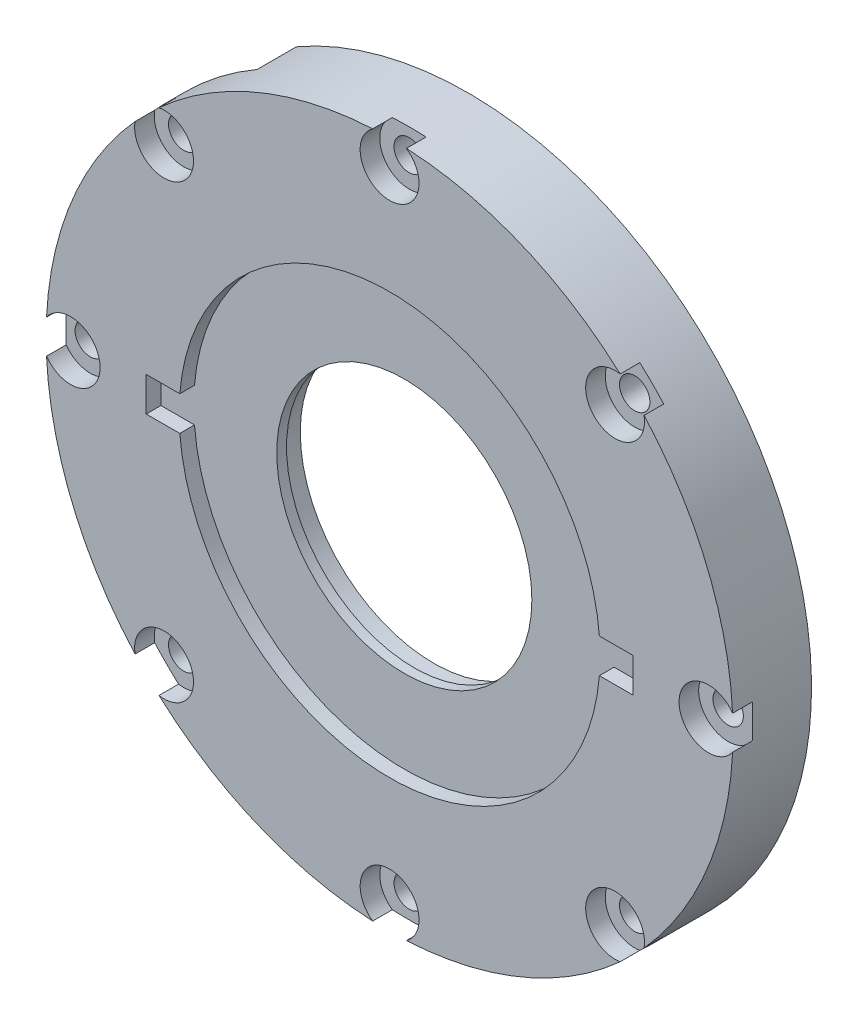
from build123d import *

# Parameters (mm, degrees)
EXTRUDE_1_OUTLINE_R   = 35
EXTRUDE_1_OUTLINE_R_2 = 1.55
EXTRUDE_1_OUTLINE_R_3 = 30.05
EXTRUDE_1_DEPTH       = 10
SKETCH_2_R            = 33.525
SKETCH_2_R_2          = 18.525
EXTRUDE_1_2_DEPTH     = 4
SKETCH_3_R            = 1.55
CUT_EXTRUDE_1_DEPTH   = 51.497524692
CUT_EXTRUDE_2_DEPTH   = 6
SKETCH_8_R            = 35
SKETCH_8_R_2          = 30.05
CUT_EXTRUDE_3_DEPTH   = 2
SKETCH_9_R            = 3
CUT_EXTRUDE_4_DEPTH   = 2
SKETCH_10_R           = 1.55
CUT_EXTRUDE_5_DEPTH   = 51.139804547
SKETCH_11_R           = 3
CUT_EXTRUDE_6_DEPTH   = 2
SKETCH_14_R           = 18.525
SKETCH_14_R_2         = 13.5
EXTRUDE_2_DEPTH       = 4
SKETCH_15_R           = 17.5
CUT_EXTRUDE_8_DEPTH   = 1.5
SKETCH_17_R           = 17.5
SKETCH_17_R_2         = 12.5
CUT_EXTRUDE_9_DEPTH   = 1
SKETCH1_R             = 13.5
SKETCH1_R_2           = 12
BOSS_EXTRUDE1_DEPTH   = 1
CUT_EXTRUDE1_START    = -2
SKETCH2_R             = 14
SKETCH2_R_2           = 13.5
CUT_EXTRUDE1_DEPTH    = 2
SKETCH3_R             = 14
SKETCH3_R_2           = 13.6
BOSS_EXTRUDE2_DEPTH   = 2
SKETCH5_R             = 12.5
SKETCH5_R_2           = 12
CUT_EXTRUDE3_DEPTH    = 50.922439844
SKETCH6_R             = 13
SKETCH6_R_2           = 12.5
CUT_EXTRUDE4_DEPTH    = 50.922439844
SKETCH7_R             = 17.5
SKETCH7_R_2           = 13.5
CUT_EXTRUDE5_DEPTH    = 0.5


# Read off the part's stored shape, not the designer's step: 凸台-拉伸1
with BuildPart() as part:
    # Extrude 1 outline → Extrude 1 (new body)
    with BuildSketch(Plane.XY):
        Circle(EXTRUDE_1_OUTLINE_R)
        with Locations((0, -32.5)):
            Circle(EXTRUDE_1_OUTLINE_R_2, mode=Mode.SUBTRACT)
        with Locations((-32.5, 0)):
            Circle(EXTRUDE_1_OUTLINE_R_2, mode=Mode.SUBTRACT)
        Circle(EXTRUDE_1_OUTLINE_R_3, mode=Mode.SUBTRACT)
        with Locations((32.5, 0)):
            Circle(EXTRUDE_1_OUTLINE_R_2, mode=Mode.SUBTRACT)
        with Locations((0, 32.5)):
            Circle(EXTRUDE_1_OUTLINE_R_2, mode=Mode.SUBTRACT)
    extrude(amount=EXTRUDE_1_DEPTH)

    # 草图2 → Extrude 1 2 (add)
    with BuildSketch(Plane.XY.offset(10)):
        Circle(SKETCH_2_R)
        Circle(SKETCH_2_R_2, mode=Mode.SUBTRACT)
    extrude(amount=-EXTRUDE_1_2_DEPTH)

    # 草图3 → 切除-拉伸1 (cut, through all)
    with BuildSketch(Plane(origin=(0, 0, 0), x_dir=(-1, 0, 0), z_dir=(0, 0, -1))):
        with Locations(Location((32.5, 0, 0), (0, 0, 180))):
            Circle(SKETCH_3_R)
        with Locations(Location((0, -32.5, 0), (0, 0, 180))):
            Circle(SKETCH_3_R)
        with Locations(Location((-32.5, 0, 0), (0, 0, 180))):
            Circle(SKETCH_3_R)
        with Locations(Location((0, 32.5, 0), (0, 0, 180))):
            Circle(SKETCH_3_R)
    extrude(amount=-CUT_EXTRUDE_1_DEPTH, mode=Mode.SUBTRACT)

    # 草图7 → 切除-拉伸2 (cut)
    with BuildSketch(Plane(origin=(0, 0, 0), x_dir=(-1, 0, 0), z_dir=(0, 0, -1))):
        with BuildLine():
            Line((15.025, 26.024063384), (17.5, 30.310889132))
            ThreePointArc((17.5, 30.310889132), (24.748737342, 24.748737342), (30.310889132, 17.5))
            Line((30.310889132, 17.5), (26.024063384, 15.025))
            ThreePointArc((26.024063384, 15.025), (21.248558775, 21.248558775), (15.025, 26.024063384))
        make_face()
    extrude(amount=-CUT_EXTRUDE_2_DEPTH, mode=Mode.SUBTRACT)

    # 草图8 → 切除-拉伸3 (cut)
    with BuildSketch(Plane(origin=(0, 0, 0), x_dir=(-1, 0, 0), z_dir=(0, 0, -1))):
        with Locations(Location((0, 0, 0), (0, 0, 30))):
            Circle(SKETCH_8_R)
        Circle(SKETCH_8_R_2, mode=Mode.SUBTRACT)
    extrude(amount=-CUT_EXTRUDE_3_DEPTH, mode=Mode.SUBTRACT)

    # 草图9 → 切除-拉伸4 (cut)
    with BuildSketch(Plane.XY.offset(10)):
        with Locations((0, 32.5)):
            Circle(SKETCH_9_R)
        with Locations((32.5, 0)):
            Circle(SKETCH_9_R)
        with Locations((0, -32.5)):
            Circle(SKETCH_9_R)
        with Locations((-32.5, 0)):
            Circle(SKETCH_9_R)
    extrude(amount=-CUT_EXTRUDE_4_DEPTH, mode=Mode.SUBTRACT)

    # 草图10 → 切除-拉伸5 (cut, through all)
    with BuildSketch(Plane.XY.offset(10)):
        with Locations((22.980970389, 22.980970389)):
            Circle(SKETCH_10_R)
        with Locations((22.980970389, -22.980970389)):
            Circle(SKETCH_10_R)
        with Locations((-22.980970389, -22.980970389)):
            Circle(SKETCH_10_R)
        with Locations((-22.980970389, 22.980970389)):
            Circle(SKETCH_10_R)
    extrude(amount=-CUT_EXTRUDE_5_DEPTH, mode=Mode.SUBTRACT)

    # 草图11 → 切除-拉伸6 (cut)
    with BuildSketch(Plane.XY.offset(10)):
        with Locations((22.980970389, 22.980970389)):
            Circle(SKETCH_11_R)
        with Locations((22.980970389, -22.980970389)):
            Circle(SKETCH_11_R)
        with Locations((-22.980970389, -22.980970389)):
            Circle(SKETCH_11_R)
        with Locations((-22.980970389, 22.980970389)):
            Circle(SKETCH_11_R)
    extrude(amount=-CUT_EXTRUDE_6_DEPTH, mode=Mode.SUBTRACT)

    # 草图14 → 凸台-拉伸2 (add)
    with BuildSketch(Plane.XY.offset(10)):
        Circle(SKETCH_14_R)
        Circle(SKETCH_14_R_2, mode=Mode.SUBTRACT)
    extrude(amount=-EXTRUDE_2_DEPTH)

    # 草图15 → 切除-拉伸8 (cut)
    with BuildSketch(Plane.XY.offset(10)):
        with BuildLine():
            ThreePointArc((21.378493867, 1.75), (0, 21.45), (-21.378493867, 1.75))
            Line((-21.378493866, 1.75), (-24.8, 1.75))
            Line((-24.8, 1.75), (-24.8, -1.75))
            Line((-24.8, -1.75), (-21.378493867, -1.75))
            ThreePointArc((-21.378493867, -1.75), (0, -21.45), (21.378493867, -1.75))
            Line((21.378493867, -1.75), (24.8, -1.75))
            Line((24.8, -1.75), (24.8, 1.75))
            Line((24.8, 1.75), (21.378493867, 1.75))
        make_face()
        Circle(SKETCH_15_R, mode=Mode.SUBTRACT)
    extrude(amount=-CUT_EXTRUDE_8_DEPTH, mode=Mode.SUBTRACT)

    # 草图17 → 切除-拉伸9 (cut)
    with BuildSketch(Plane.XY.offset(10)):
        Circle(SKETCH_17_R)
        Circle(SKETCH_17_R_2, mode=Mode.SUBTRACT)
    extrude(amount=-CUT_EXTRUDE_9_DEPTH, mode=Mode.SUBTRACT)

    # Sketch1 → Boss-Extrude1 (add)
    with BuildSketch(Plane.XY.offset(8.5)):
        Circle(SKETCH1_R)
        Circle(SKETCH1_R_2, mode=Mode.SUBTRACT)
    extrude(amount=-BOSS_EXTRUDE1_DEPTH)

    # Sketch2 → Cut-Extrude1 (cut)
    with BuildSketch(Plane(origin=(0, 0, 6), x_dir=(-1, 0, 0), z_dir=(0, 0, -1)).offset(CUT_EXTRUDE1_START)):
        Circle(SKETCH2_R)
        with Locations(Location((0, 0, 0), (0, 0, 180))):
            Circle(SKETCH2_R_2, mode=Mode.SUBTRACT)
    extrude(amount=CUT_EXTRUDE1_DEPTH, mode=Mode.SUBTRACT)

    # Sketch3 → Boss-Extrude2 (add)
    with BuildSketch(Plane(origin=(0, 0, 7.5), x_dir=(-1, 0, 0), z_dir=(0, 0, -1))):
        Circle(SKETCH3_R)
        Circle(SKETCH3_R_2, mode=Mode.SUBTRACT)
    extrude(amount=BOSS_EXTRUDE2_DEPTH)

    # Sketch5 → Cut-Extrude3 (cut, through all)
    with BuildSketch(Plane.XY.offset(8.5)):
        Circle(SKETCH5_R)
        Circle(SKETCH5_R_2, mode=Mode.SUBTRACT)
    extrude(amount=-CUT_EXTRUDE3_DEPTH, mode=Mode.SUBTRACT)

    # Sketch6 → Cut-Extrude4 (cut, through all)
    with BuildSketch(Plane.XY.offset(8.5)):
        Circle(SKETCH6_R)
        Circle(SKETCH6_R_2, mode=Mode.SUBTRACT)
    extrude(amount=-CUT_EXTRUDE4_DEPTH, mode=Mode.SUBTRACT)

    # Sketch7 → Cut-Extrude5 (cut)
    with BuildSketch(Plane.XY.offset(9)):
        Circle(SKETCH7_R)
        with Locations(Location((0, 0, 0), (0, 0, 180))):
            Circle(SKETCH7_R_2, mode=Mode.SUBTRACT)
    extrude(amount=-CUT_EXTRUDE5_DEPTH, mode=Mode.SUBTRACT)


solid = part.part
